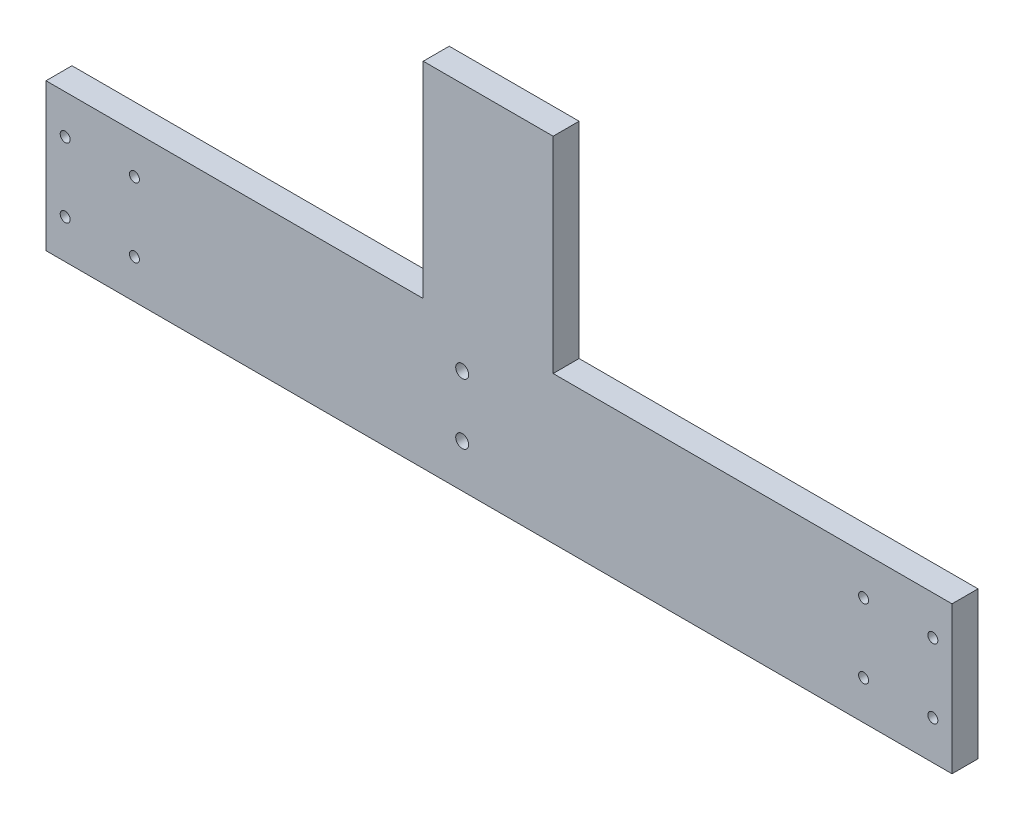
from build123d import *

# Parameters (mm, degrees)
BOSS_EXTRU_1_DEPTH      = 6
ESQUISSE2_R             = 1.15
ESQUISSE2_R_2           = 1.5
ENL_V_MAT_EXTRU_1_DEPTH = 6


with BuildPart() as part:
    # Esquisse1 → Boss.-Extru.1 (new body)
    with BuildSketch(Plane.XY):
        Polygon((-104.63, 17), (-17.5, 17), (-17.5, 64.470970022), (12.5, 64.470970022), (12.5, 17), (104.63, 17), (104.63, -17), (-104.63, -17), align=None)
    extrude(amount=BOSS_EXTRU_1_DEPTH)

    # Esquisse2 → Enlèv. mat.-Extru.1 (cut)
    with BuildSketch(Plane.XY.offset(6)):
        with Locations((-100.2, 8)):
            Circle(ESQUISSE2_R)
        with Locations((-84.2, 8)):
            Circle(ESQUISSE2_R)
        with Locations((-84.2, -8)):
            Circle(ESQUISSE2_R)
        with Locations((-100.2, -8)):
            Circle(ESQUISSE2_R)
        with Locations((100.2, -8)):
            Circle(ESQUISSE2_R)
        with Locations((84.2, -8)):
            Circle(ESQUISSE2_R)
        with Locations((84.2, 8)):
            Circle(ESQUISSE2_R)
        with Locations((100.2, 8)):
            Circle(ESQUISSE2_R)
        with Locations((-8.5, 7)):
            Circle(ESQUISSE2_R_2)
        with Locations((-8.5, -7)):
            Circle(ESQUISSE2_R_2)
    extrude(amount=-ENL_V_MAT_EXTRU_1_DEPTH, mode=Mode.SUBTRACT)


solid = part.part
